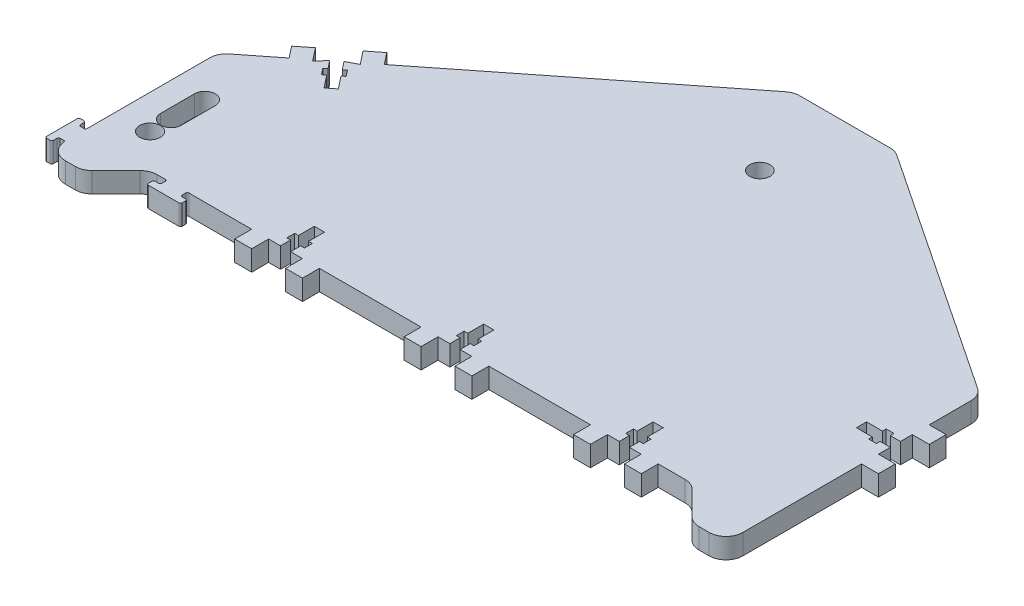
from build123d import *

# Parameters (mm, degrees)
SKETCH1_R           = 3
SKETCH1_R_2         = 3.05
BOSS_EXTRUDE1_DEPTH = 6
FILLET2_R           = 5
FILLET3_R           = 0.5


with BuildPart() as part:
    # Sketch1 → Boss-Extrude1 (new body)
    with BuildSketch(Plane(origin=(0, 0, 0), x_dir=(1, 0, 0), z_dir=(0, 1, 0))):
        Polygon((-15, 125), (15, 125), (90, 75), (90, 60), (95, 60), (95, 55), (90, 55), (90, 51.5), (87, 51.5), (87, 52.6), (84.7, 52.6), (84.7, 51.5), (80, 51.5), (80, 48.5), (84.7, 48.5), (84.7, 47.4), (87, 47.4), (87, 48.5), (90, 48.5), (90, 45), (95, 45), (95, 40), (90, 40), (90, 0), (80, 0), (70, 10), (60, 10), (60, 5), (55, 5), (55, 10), (51.5, 10), (51.5, 13), (52.6, 13), (52.6, 15.3), (51.5, 15.3), (51.5, 20), (48.5, 20), (48.5, 15.3), (47.4, 15.3), (47.4, 13), (48.5, 13), (48.5, 10), (45, 10), (45, 5), (40, 5), (40, 10), (10, 10), (10, 5), (5, 5), (5, 10), (1.5, 10), (1.5, 13), (2.6, 13), (2.6, 15.3), (1.5, 15.3), (1.5, 20), (-1.5, 20), (-1.5, 15.3), (-2.6, 15.3), (-2.6, 13), (-1.5, 13), (-1.5, 10), (-5, 10), (-5, 5), (-10, 5), (-10, 10), (-40, 10), (-40, 5), (-45, 5), (-45, 10), (-48.5, 10), (-48.5, 13), (-47.4, 13), (-47.4, 15.3), (-48.5, 15.3), (-48.5, 20), (-51.5, 20), (-51.5, 15.3), (-52.6, 15.3), (-52.6, 13), (-51.5, 13), (-51.5, 10), (-55, 10), (-55, 5), (-60, 5), (-60, 10), (-79, 10), (-79, 8), (-77, 8), (-77, 6), (-87, 6), (-87, 8), (-85, 8), (-85, 10), (-90, 10), (-100, 0), (-110, 0), (-110, 5), (-112, 5), (-112, 3), (-114, 3), (-114, 13), (-112, 13), (-112, 11), (-110, 11), (-110, 50), (-98.226758517, 59.294664329), (-100.912325962, 62.696383092), (-96.987912134, 65.794604535), (-93.958002959, 61.95671958), (-91.617355107, 64.640300905), (-89.758422242, 62.285652608), (-90.621793284, 61.604043891), (-89.19661142, 59.79881353), (-88.333240378, 60.480422248), (-85.420912221, 56.79147325), (-83.066263925, 58.650406115), (-85.978592081, 62.339355113), (-85.115221039, 63.020963831), (-86.540402903, 64.826194191), (-87.403773945, 64.144585474), (-89.262706811, 66.499233771), (-86.109175304, 68.153162466), (-89.139084479, 71.991047421), (-85.214670651, 75.089268863), (-82.529103206, 71.6875501), align=None)
        with Locations(Location((0, 100, 0), (0, 0, 270))):
            Circle(SKETCH1_R, mode=Mode.SUBTRACT)
        with Locations(Location((-100, 20, 0), (0, 0, 270))):
            Circle(SKETCH1_R_2, mode=Mode.SUBTRACT)
        with BuildLine():
            Line((-103.05, 26.2), (-103.05, 36.2))
            ThreePointArc((-103.05, 36.2), (-100, 39.25), (-96.95, 36.2))
            Line((-96.95, 36.2), (-96.95, 26.2))
            ThreePointArc((-96.95, 26.2), (-100, 23.15), (-103.05, 26.2))
        make_face(mode=Mode.SUBTRACT)
    extrude(amount=BOSS_EXTRUDE1_DEPTH)

    # Fillet2
    fillet2_edges = [part.edges().sort_by_distance(p)[0] for p in [
        (-100, 3, 0),
        (-110, 3, 0),
        (-110, 3, -50),
        (-15, 3, -125),
        (15, 3, -125),
        (90, 3, -75),
        (90, 3, 0),
        (80, 3, 0),
        (70, 3, -10),
        (-90, 3, -10),
    ]]
    fillet(fillet2_edges, radius=FILLET2_R - 0.0001)  # a hair under: the kernel refuses the full size

    # Fillet3
    fillet3_edges = [part.edges().sort_by_distance(p)[0] for p in [
        (-110, 3, -5),
        (-112, 3, -5),
        (-112, 3, -3),
        (-114, 3, -3),
        (-114, 3, -13),
        (-112, 3, -13),
        (-112, 3, -11),
        (-110, 3, -11),
        (-79, 3, -10),
        (-79, 3, -8),
        (-77, 3, -8),
        (-77, 3, -6),
        (-87, 3, -6),
        (-87, 3, -8),
        (-85, 3, -8),
        (-85, 3, -10),
    ]]
    fillet(fillet3_edges, radius=FILLET3_R)


solid = part.part
